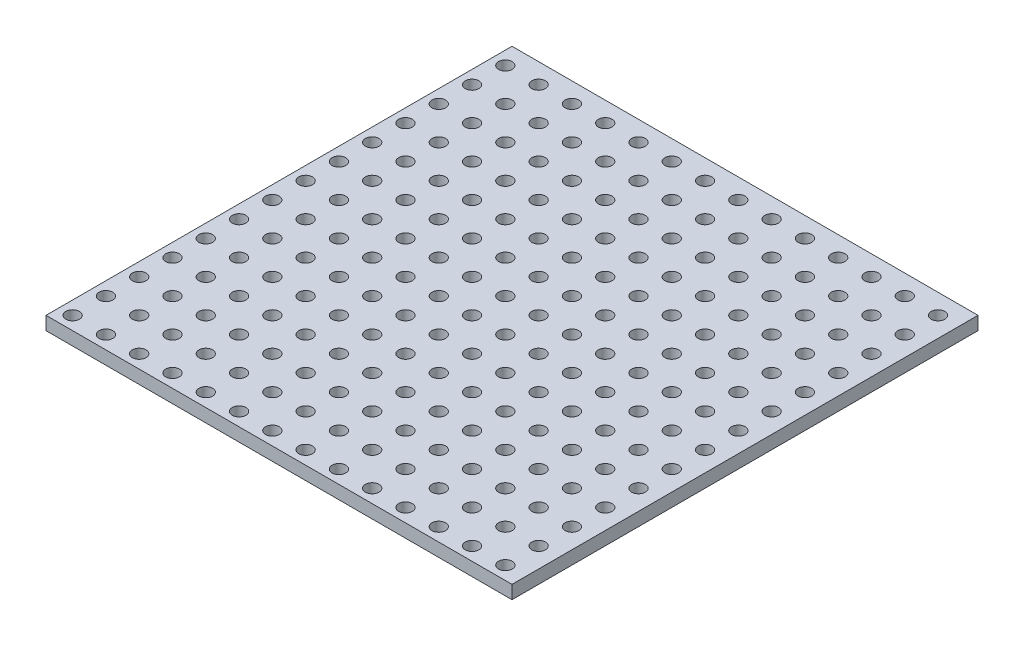
from build123d import *

# Parameters (mm, degrees)
SKETCH2_W               = 350
SKETCH2_H               = 350
BOSS_EXTRUDE2_DEPTH     = 10
ADVANCEDHOLE1_OUTLINE_R = 5.125
ADVANCEDHOLE1_DEPTH     = 10


# Read off the part's stored shape, not the designer's step: AdvancedHole1
with BuildPart() as part:
    # Sketch2 → Boss-Extrude2 (new body)
    with BuildSketch(Plane(origin=(0, 0, 0), x_dir=(1, 0, 0), z_dir=(0, 1, 0))):
        with Locations((175, 175)):
            Rectangle(SKETCH2_W, SKETCH2_H)
    extrude(amount=BOSS_EXTRUDE2_DEPTH)

    # AdvancedHole1 outline → AdvancedHole1 (cut)
    with BuildSketch(Plane(origin=(0, 0, 0), x_dir=(1, 0, 0), z_dir=(0, 1, 0))):
        with Locations((10, 310)):
            Circle(ADVANCEDHOLE1_OUTLINE_R)
        with Locations((10, 335)):
            Circle(ADVANCEDHOLE1_OUTLINE_R)
        with Locations((35, 335)):
            Circle(ADVANCEDHOLE1_OUTLINE_R)
        with Locations((35, 310)):
            Circle(ADVANCEDHOLE1_OUTLINE_R)
        with Locations((60, 335)):
            Circle(ADVANCEDHOLE1_OUTLINE_R)
        with Locations((85, 335)):
            Circle(ADVANCEDHOLE1_OUTLINE_R)
        with Locations((60, 310)):
            Circle(ADVANCEDHOLE1_OUTLINE_R)
        with Locations((85, 310)):
            Circle(ADVANCEDHOLE1_OUTLINE_R)
        with Locations((10, 285)):
            Circle(ADVANCEDHOLE1_OUTLINE_R)
        with Locations((35, 285)):
            Circle(ADVANCEDHOLE1_OUTLINE_R)
        with Locations((60, 285)):
            Circle(ADVANCEDHOLE1_OUTLINE_R)
        with Locations((85, 285)):
            Circle(ADVANCEDHOLE1_OUTLINE_R)
        with Locations((10, 260)):
            Circle(ADVANCEDHOLE1_OUTLINE_R)
        with Locations((35, 260)):
            Circle(ADVANCEDHOLE1_OUTLINE_R)
        with Locations((60, 260)):
            Circle(ADVANCEDHOLE1_OUTLINE_R)
        with Locations((85, 260)):
            Circle(ADVANCEDHOLE1_OUTLINE_R)
        with Locations((110, 285)):
            Circle(ADVANCEDHOLE1_OUTLINE_R)
        with Locations((110, 310)):
            Circle(ADVANCEDHOLE1_OUTLINE_R)
        with Locations((110, 335)):
            Circle(ADVANCEDHOLE1_OUTLINE_R)
        with Locations((135, 285)):
            Circle(ADVANCEDHOLE1_OUTLINE_R)
        with Locations((135, 310)):
            Circle(ADVANCEDHOLE1_OUTLINE_R)
        with Locations((135, 335)):
            Circle(ADVANCEDHOLE1_OUTLINE_R)
        with Locations((160, 335)):
            Circle(ADVANCEDHOLE1_OUTLINE_R)
        with Locations((160, 310)):
            Circle(ADVANCEDHOLE1_OUTLINE_R)
        with Locations((110, 260)):
            Circle(ADVANCEDHOLE1_OUTLINE_R)
        with Locations((135, 260)):
            Circle(ADVANCEDHOLE1_OUTLINE_R)
        with Locations((160, 285)):
            Circle(ADVANCEDHOLE1_OUTLINE_R)
        with Locations((160, 260)):
            Circle(ADVANCEDHOLE1_OUTLINE_R)
        with Locations((185, 335)):
            Circle(ADVANCEDHOLE1_OUTLINE_R)
        with Locations((185, 310)):
            Circle(ADVANCEDHOLE1_OUTLINE_R)
        with Locations((185, 285)):
            Circle(ADVANCEDHOLE1_OUTLINE_R)
        with Locations((185, 260)):
            Circle(ADVANCEDHOLE1_OUTLINE_R)
        with Locations((210, 310)):
            Circle(ADVANCEDHOLE1_OUTLINE_R)
        with Locations((210, 335)):
            Circle(ADVANCEDHOLE1_OUTLINE_R)
        with Locations((235, 310)):
            Circle(ADVANCEDHOLE1_OUTLINE_R)
        with Locations((235, 335)):
            Circle(ADVANCEDHOLE1_OUTLINE_R)
        with Locations((260, 310)):
            Circle(ADVANCEDHOLE1_OUTLINE_R)
        with Locations((285, 310)):
            Circle(ADVANCEDHOLE1_OUTLINE_R)
        with Locations((260, 335)):
            Circle(ADVANCEDHOLE1_OUTLINE_R)
        with Locations((285, 335)):
            Circle(ADVANCEDHOLE1_OUTLINE_R)
        with Locations((310, 335)):
            Circle(ADVANCEDHOLE1_OUTLINE_R)
        with Locations((335, 335)):
            Circle(ADVANCEDHOLE1_OUTLINE_R)
        with Locations((310, 310)):
            Circle(ADVANCEDHOLE1_OUTLINE_R)
        with Locations((335, 310)):
            Circle(ADVANCEDHOLE1_OUTLINE_R)
        with Locations((210, 285)):
            Circle(ADVANCEDHOLE1_OUTLINE_R)
        with Locations((235, 285)):
            Circle(ADVANCEDHOLE1_OUTLINE_R)
        with Locations((260, 285)):
            Circle(ADVANCEDHOLE1_OUTLINE_R)
        with Locations((285, 285)):
            Circle(ADVANCEDHOLE1_OUTLINE_R)
        with Locations((310, 285)):
            Circle(ADVANCEDHOLE1_OUTLINE_R)
        with Locations((335, 285)):
            Circle(ADVANCEDHOLE1_OUTLINE_R)
        with Locations((210, 260)):
            Circle(ADVANCEDHOLE1_OUTLINE_R)
        with Locations((235, 260)):
            Circle(ADVANCEDHOLE1_OUTLINE_R)
        with Locations((260, 260)):
            Circle(ADVANCEDHOLE1_OUTLINE_R)
        with Locations((285, 260)):
            Circle(ADVANCEDHOLE1_OUTLINE_R)
        with Locations((310, 260)):
            Circle(ADVANCEDHOLE1_OUTLINE_R)
        with Locations((335, 260)):
            Circle(ADVANCEDHOLE1_OUTLINE_R)
        with Locations((10, 235)):
            Circle(ADVANCEDHOLE1_OUTLINE_R)
        with Locations((35, 235)):
            Circle(ADVANCEDHOLE1_OUTLINE_R)
        with Locations((60, 235)):
            Circle(ADVANCEDHOLE1_OUTLINE_R)
        with Locations((85, 235)):
            Circle(ADVANCEDHOLE1_OUTLINE_R)
        with Locations((110, 235)):
            Circle(ADVANCEDHOLE1_OUTLINE_R)
        with Locations((135, 235)):
            Circle(ADVANCEDHOLE1_OUTLINE_R)
        with Locations((160, 235)):
            Circle(ADVANCEDHOLE1_OUTLINE_R)
        with Locations((185, 235)):
            Circle(ADVANCEDHOLE1_OUTLINE_R)
        with Locations((210, 235)):
            Circle(ADVANCEDHOLE1_OUTLINE_R)
        with Locations((235, 235)):
            Circle(ADVANCEDHOLE1_OUTLINE_R)
        with Locations((260, 235)):
            Circle(ADVANCEDHOLE1_OUTLINE_R)
        with Locations((285, 235)):
            Circle(ADVANCEDHOLE1_OUTLINE_R)
        with Locations((310, 235)):
            Circle(ADVANCEDHOLE1_OUTLINE_R)
        with Locations((335, 235)):
            Circle(ADVANCEDHOLE1_OUTLINE_R)
        with Locations((10, 210)):
            Circle(ADVANCEDHOLE1_OUTLINE_R)
        with Locations((35, 210)):
            Circle(ADVANCEDHOLE1_OUTLINE_R)
        with Locations((60, 210)):
            Circle(ADVANCEDHOLE1_OUTLINE_R)
        with Locations((85, 210)):
            Circle(ADVANCEDHOLE1_OUTLINE_R)
        with Locations((110, 210)):
            Circle(ADVANCEDHOLE1_OUTLINE_R)
        with Locations((135, 210)):
            Circle(ADVANCEDHOLE1_OUTLINE_R)
        with Locations((160, 210)):
            Circle(ADVANCEDHOLE1_OUTLINE_R)
        with Locations((185, 210)):
            Circle(ADVANCEDHOLE1_OUTLINE_R)
        with Locations((210, 210)):
            Circle(ADVANCEDHOLE1_OUTLINE_R)
        with Locations((235, 210)):
            Circle(ADVANCEDHOLE1_OUTLINE_R)
        with Locations((260, 210)):
            Circle(ADVANCEDHOLE1_OUTLINE_R)
        with Locations((285, 210)):
            Circle(ADVANCEDHOLE1_OUTLINE_R)
        with Locations((310, 210)):
            Circle(ADVANCEDHOLE1_OUTLINE_R)
        with Locations((335, 210)):
            Circle(ADVANCEDHOLE1_OUTLINE_R)
        with Locations((10, 185)):
            Circle(ADVANCEDHOLE1_OUTLINE_R)
        with Locations((35, 185)):
            Circle(ADVANCEDHOLE1_OUTLINE_R)
        with Locations((60, 185)):
            Circle(ADVANCEDHOLE1_OUTLINE_R)
        with Locations((85, 185)):
            Circle(ADVANCEDHOLE1_OUTLINE_R)
        with Locations((110, 185)):
            Circle(ADVANCEDHOLE1_OUTLINE_R)
        with Locations((135, 185)):
            Circle(ADVANCEDHOLE1_OUTLINE_R)
        with Locations((160, 185)):
            Circle(ADVANCEDHOLE1_OUTLINE_R)
        with Locations((185, 185)):
            Circle(ADVANCEDHOLE1_OUTLINE_R)
        with Locations((210, 185)):
            Circle(ADVANCEDHOLE1_OUTLINE_R)
        with Locations((235, 185)):
            Circle(ADVANCEDHOLE1_OUTLINE_R)
        with Locations((260, 185)):
            Circle(ADVANCEDHOLE1_OUTLINE_R)
        with Locations((285, 185)):
            Circle(ADVANCEDHOLE1_OUTLINE_R)
        with Locations((310, 185)):
            Circle(ADVANCEDHOLE1_OUTLINE_R)
        with Locations((335, 185)):
            Circle(ADVANCEDHOLE1_OUTLINE_R)
        with Locations((10, 160)):
            Circle(ADVANCEDHOLE1_OUTLINE_R)
        with Locations((35, 160)):
            Circle(ADVANCEDHOLE1_OUTLINE_R)
        with Locations((60, 160)):
            Circle(ADVANCEDHOLE1_OUTLINE_R)
        with Locations((85, 160)):
            Circle(ADVANCEDHOLE1_OUTLINE_R)
        with Locations((110, 160)):
            Circle(ADVANCEDHOLE1_OUTLINE_R)
        with Locations((135, 160)):
            Circle(ADVANCEDHOLE1_OUTLINE_R)
        with Locations((160, 160)):
            Circle(ADVANCEDHOLE1_OUTLINE_R)
        with Locations((185, 160)):
            Circle(ADVANCEDHOLE1_OUTLINE_R)
        with Locations((210, 160)):
            Circle(ADVANCEDHOLE1_OUTLINE_R)
        with Locations((235, 160)):
            Circle(ADVANCEDHOLE1_OUTLINE_R)
        with Locations((260, 160)):
            Circle(ADVANCEDHOLE1_OUTLINE_R)
        with Locations((285, 160)):
            Circle(ADVANCEDHOLE1_OUTLINE_R)
        with Locations((310, 160)):
            Circle(ADVANCEDHOLE1_OUTLINE_R)
        with Locations((335, 160)):
            Circle(ADVANCEDHOLE1_OUTLINE_R)
        with Locations((10, 135)):
            Circle(ADVANCEDHOLE1_OUTLINE_R)
        with Locations((35, 135)):
            Circle(ADVANCEDHOLE1_OUTLINE_R)
        with Locations((60, 135)):
            Circle(ADVANCEDHOLE1_OUTLINE_R)
        with Locations((85, 135)):
            Circle(ADVANCEDHOLE1_OUTLINE_R)
        with Locations((110, 135)):
            Circle(ADVANCEDHOLE1_OUTLINE_R)
        with Locations((135, 135)):
            Circle(ADVANCEDHOLE1_OUTLINE_R)
        with Locations((160, 135)):
            Circle(ADVANCEDHOLE1_OUTLINE_R)
        with Locations((185, 135)):
            Circle(ADVANCEDHOLE1_OUTLINE_R)
        with Locations((210, 135)):
            Circle(ADVANCEDHOLE1_OUTLINE_R)
        with Locations((235, 135)):
            Circle(ADVANCEDHOLE1_OUTLINE_R)
        with Locations((260, 135)):
            Circle(ADVANCEDHOLE1_OUTLINE_R)
        with Locations((285, 135)):
            Circle(ADVANCEDHOLE1_OUTLINE_R)
        with Locations((310, 135)):
            Circle(ADVANCEDHOLE1_OUTLINE_R)
        with Locations((335, 135)):
            Circle(ADVANCEDHOLE1_OUTLINE_R)
        with Locations((10, 110)):
            Circle(ADVANCEDHOLE1_OUTLINE_R)
        with Locations((35, 110)):
            Circle(ADVANCEDHOLE1_OUTLINE_R)
        with Locations((60, 110)):
            Circle(ADVANCEDHOLE1_OUTLINE_R)
        with Locations((85, 110)):
            Circle(ADVANCEDHOLE1_OUTLINE_R)
        with Locations((110, 110)):
            Circle(ADVANCEDHOLE1_OUTLINE_R)
        with Locations((135, 110)):
            Circle(ADVANCEDHOLE1_OUTLINE_R)
        with Locations((160, 110)):
            Circle(ADVANCEDHOLE1_OUTLINE_R)
        with Locations((185, 110)):
            Circle(ADVANCEDHOLE1_OUTLINE_R)
        with Locations((210, 110)):
            Circle(ADVANCEDHOLE1_OUTLINE_R)
        with Locations((235, 110)):
            Circle(ADVANCEDHOLE1_OUTLINE_R)
        with Locations((260, 110)):
            Circle(ADVANCEDHOLE1_OUTLINE_R)
        with Locations((285, 110)):
            Circle(ADVANCEDHOLE1_OUTLINE_R)
        with Locations((310, 110)):
            Circle(ADVANCEDHOLE1_OUTLINE_R)
        with Locations((335, 110)):
            Circle(ADVANCEDHOLE1_OUTLINE_R)
        with Locations((10, 85)):
            Circle(ADVANCEDHOLE1_OUTLINE_R)
        with Locations((35, 85)):
            Circle(ADVANCEDHOLE1_OUTLINE_R)
        with Locations((60, 85)):
            Circle(ADVANCEDHOLE1_OUTLINE_R)
        with Locations((85, 85)):
            Circle(ADVANCEDHOLE1_OUTLINE_R)
        with Locations((110, 85)):
            Circle(ADVANCEDHOLE1_OUTLINE_R)
        with Locations((135, 85)):
            Circle(ADVANCEDHOLE1_OUTLINE_R)
        with Locations((160, 85)):
            Circle(ADVANCEDHOLE1_OUTLINE_R)
        with Locations((185, 85)):
            Circle(ADVANCEDHOLE1_OUTLINE_R)
        with Locations((210, 85)):
            Circle(ADVANCEDHOLE1_OUTLINE_R)
        with Locations((235, 85)):
            Circle(ADVANCEDHOLE1_OUTLINE_R)
        with Locations((260, 85)):
            Circle(ADVANCEDHOLE1_OUTLINE_R)
        with Locations((285, 85)):
            Circle(ADVANCEDHOLE1_OUTLINE_R)
        with Locations((310, 85)):
            Circle(ADVANCEDHOLE1_OUTLINE_R)
        with Locations((335, 85)):
            Circle(ADVANCEDHOLE1_OUTLINE_R)
        with Locations((335, 60)):
            Circle(ADVANCEDHOLE1_OUTLINE_R)
        with Locations((310, 60)):
            Circle(ADVANCEDHOLE1_OUTLINE_R)
        with Locations((285, 60)):
            Circle(ADVANCEDHOLE1_OUTLINE_R)
        with Locations((260, 60)):
            Circle(ADVANCEDHOLE1_OUTLINE_R)
        with Locations((235, 60)):
            Circle(ADVANCEDHOLE1_OUTLINE_R)
        with Locations((210, 60)):
            Circle(ADVANCEDHOLE1_OUTLINE_R)
        with Locations((185, 60)):
            Circle(ADVANCEDHOLE1_OUTLINE_R)
        with Locations((160, 60)):
            Circle(ADVANCEDHOLE1_OUTLINE_R)
        with Locations((135, 60)):
            Circle(ADVANCEDHOLE1_OUTLINE_R)
        with Locations((110, 60)):
            Circle(ADVANCEDHOLE1_OUTLINE_R)
        with Locations((85, 60)):
            Circle(ADVANCEDHOLE1_OUTLINE_R)
        with Locations((60, 60)):
            Circle(ADVANCEDHOLE1_OUTLINE_R)
        with Locations((35, 60)):
            Circle(ADVANCEDHOLE1_OUTLINE_R)
        with Locations((10, 60)):
            Circle(ADVANCEDHOLE1_OUTLINE_R)
        with Locations((10, 35)):
            Circle(ADVANCEDHOLE1_OUTLINE_R)
        with Locations((35, 35)):
            Circle(ADVANCEDHOLE1_OUTLINE_R)
        with Locations((60, 35)):
            Circle(ADVANCEDHOLE1_OUTLINE_R)
        with Locations((85, 35)):
            Circle(ADVANCEDHOLE1_OUTLINE_R)
        with Locations((110, 35)):
            Circle(ADVANCEDHOLE1_OUTLINE_R)
        with Locations((135, 35)):
            Circle(ADVANCEDHOLE1_OUTLINE_R)
        with Locations((160, 35)):
            Circle(ADVANCEDHOLE1_OUTLINE_R)
        with Locations((185, 35)):
            Circle(ADVANCEDHOLE1_OUTLINE_R)
        with Locations((210, 35)):
            Circle(ADVANCEDHOLE1_OUTLINE_R)
        with Locations((235, 35)):
            Circle(ADVANCEDHOLE1_OUTLINE_R)
        with Locations((260, 35)):
            Circle(ADVANCEDHOLE1_OUTLINE_R)
        with Locations((285, 35)):
            Circle(ADVANCEDHOLE1_OUTLINE_R)
        with Locations((310, 35)):
            Circle(ADVANCEDHOLE1_OUTLINE_R)
        with Locations((335, 35)):
            Circle(ADVANCEDHOLE1_OUTLINE_R)
        with Locations((10, 10)):
            Circle(ADVANCEDHOLE1_OUTLINE_R)
        with Locations((35, 10)):
            Circle(ADVANCEDHOLE1_OUTLINE_R)
        with Locations((60, 10)):
            Circle(ADVANCEDHOLE1_OUTLINE_R)
        with Locations((85, 10)):
            Circle(ADVANCEDHOLE1_OUTLINE_R)
        with Locations((110, 10)):
            Circle(ADVANCEDHOLE1_OUTLINE_R)
        with Locations((135, 10)):
            Circle(ADVANCEDHOLE1_OUTLINE_R)
        with Locations((160, 10)):
            Circle(ADVANCEDHOLE1_OUTLINE_R)
        with Locations((185, 10)):
            Circle(ADVANCEDHOLE1_OUTLINE_R)
        with Locations((210, 10)):
            Circle(ADVANCEDHOLE1_OUTLINE_R)
        with Locations((235, 10)):
            Circle(ADVANCEDHOLE1_OUTLINE_R)
        with Locations((260, 10)):
            Circle(ADVANCEDHOLE1_OUTLINE_R)
        with Locations((285, 10)):
            Circle(ADVANCEDHOLE1_OUTLINE_R)
        with Locations((310, 10)):
            Circle(ADVANCEDHOLE1_OUTLINE_R)
        with Locations((335, 10)):
            Circle(ADVANCEDHOLE1_OUTLINE_R)
    extrude(amount=ADVANCEDHOLE1_DEPTH, mode=Mode.SUBTRACT)


solid = part.part
